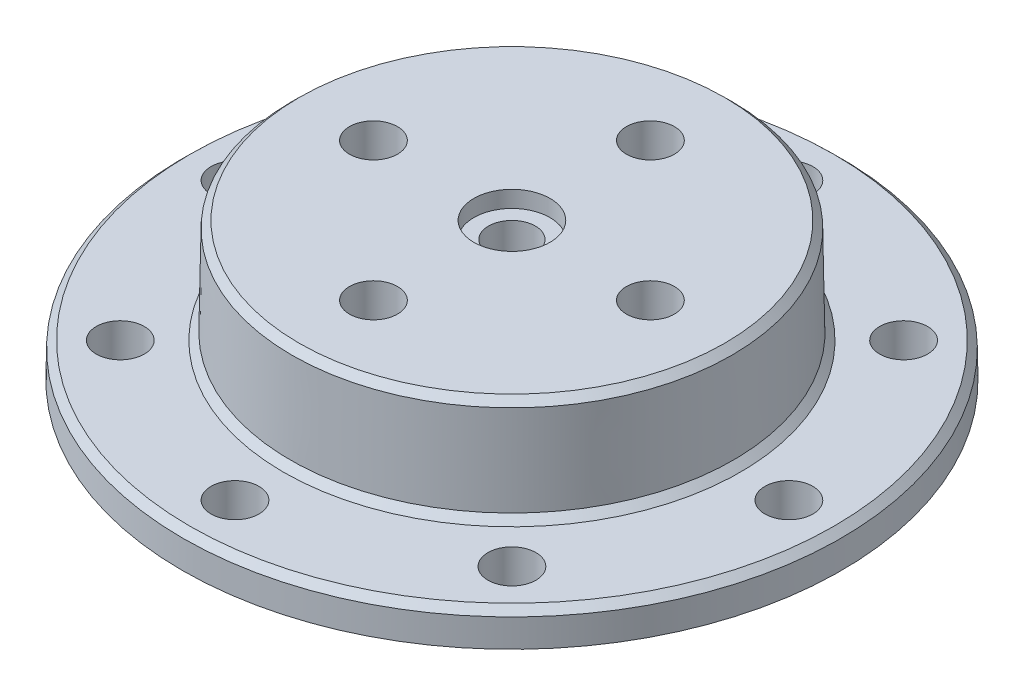
from build123d import *

# Parameters (mm, degrees)
SKETCH2_R                                        = 20.32
BOSS_EXTRUDE1_DEPTH                              = 9.525
BOSS_EXTRUDE1_TAPER                              = 1
CUT_EXTRUDE1_DEPTH                               = 1.675
CUT_EXTRUDE2_DEPTH                               = 1.675
CUT_EXTRUDE3_DEPTH                               = 1.675
CUT_EXTRUDE4_DEPTH                               = 1.675
CUT_EXTRUDE5_DEPTH                               = 1.675
CUT_EXTRUDE6_DEPTH                               = 1.675
CUT_EXTRUDE7_DEPTH                               = 1.675
CUT_EXTRUDE8_DEPTH                               = 1.675
SKETCH11_W                                       = 4
SKETCH11_H                                       = 6.374
F_4_4_4_4_DIAMETER_HOLE1_D                       = 4.4
F_4_4_4_4_DIAMETER_HOLE2_D                       = 4.4
CBORE_FOR_M4_HEX_HEAD_MACHINE_SCREW1_D           = 4.3
CBORE_FOR_M4_HEX_HEAD_MACHINE_SCREW1_CBORE_D     = 6.985
CBORE_FOR_M4_HEX_HEAD_MACHINE_SCREW1_CBORE_DEPTH = 1.524
CHAMFER1_SIZE                                    = 0.635014452
CHAMFER1_SIZE2                                   = 0.635014007
CHAMFER2_SIZE                                    = 0.634991023
CHAMFER2_SIZE_2                                  = 0.634990726
CHAMFER3_SIZE                                    = 0.635002922
CHAMFER3_SIZE2                                   = 0.635003014


with BuildPart() as part:
    # Sketch1 → Revolve1 (revolve)
    with BuildSketch(Plane(origin=(0, 0, 0), x_dir=(-1, 0, 0), z_dir=(0, 0, -1)), mode=Mode.PRIVATE) as revolve1_sk:
        Polygon((-30.226, -3.175), (-18.82, -3.175), (-18.764580169, 0), (-30.170580169, 0), align=None)
    revolve(revolve1_sk.sketch.rotate(Axis((0, -3.175, 0), (0, 1, 0)), 270), axis=Axis((0, -3.175, 0), (0, 1, 0)))

    # Sketch2 → Boss-Extrude1 (add)
    with BuildSketch(Plane(origin=(0, 0, 0), x_dir=(-1, 0, 0), z_dir=(0, 1, 0))):
        Circle(SKETCH2_R)
    extrude(amount=BOSS_EXTRUDE1_DEPTH, taper=BOSS_EXTRUDE1_TAPER)

    # Sketch3 → Cut-Extrude1 (cut)
    with BuildSketch(Plane.XZ.offset(3.175)):
        with BuildLine():
            Line((-0.75, 20.30615424), (-0.75, 21.725765386))
            ThreePointArc((-0.75, 21.725765386), (-3.704512163, 24.817685966), (-1.841086622, 28.666940472))
            ThreePointArc((-1.841086622, 28.666940472), (-10.992964278, 26.539363451), (-18.968743169, 21.572432839))
            ThreePointArc((-18.968743169, 21.572432839), (-14.929268369, 20.168239712), (-14.832105945, 15.892766117))
            Line((-14.832105945, 15.892766117), (-13.828289277, 14.888949448))
            ThreePointArc((-13.828289277, 14.888949448), (-7.776127346, 18.773232101), (-0.75, 20.30615424))
        make_face()
    extrude(amount=-CUT_EXTRUDE1_DEPTH, mode=Mode.SUBTRACT)

    # Sketch4 → Cut-Extrude2 (cut)
    with BuildSketch(Plane.XZ.offset(3.175)):
        with BuildLine():
            Line((0.75, 21.725765386), (0.75, 20.30615424))
            ThreePointArc((0.75, 20.30615424), (7.776127346, 18.773232101), (13.828289277, 14.888949448))
            Line((13.828289277, 14.888949448), (14.832105945, 15.892766117))
            ThreePointArc((14.832105945, 15.892766117), (14.929268369, 20.168239712), (18.968743169, 21.572432839))
            ThreePointArc((18.968743169, 21.572432839), (10.992964278, 26.539363451), (1.841086622, 28.666940472))
            ThreePointArc((1.841086622, 28.666940472), (3.704512163, 24.817685966), (0.75, 21.725765386))
        make_face()
    extrude(amount=-CUT_EXTRUDE2_DEPTH, mode=Mode.SUBTRACT)

    # Sketch5 → Cut-Extrude3 (cut)
    with BuildSketch(Plane.XZ.offset(3.175)):
        with BuildLine():
            Line((15.892766117, 14.832105945), (14.888949448, 13.828289277))
            ThreePointArc((14.888949448, 13.828289277), (18.773232101, 7.776127346), (20.30615424, 0.75))
            Line((20.30615424, 0.75), (21.725765386, 0.75))
            ThreePointArc((21.725765386, 0.75), (24.817685966, 3.704512163), (28.666940472, 1.841086622))
            ThreePointArc((28.666940472, 1.841086622), (26.539363451, 10.992964278), (21.572432839, 18.968743169))
            ThreePointArc((21.572432839, 18.968743169), (20.168239712, 14.929268369), (15.892766117, 14.832105945))
        make_face()
    extrude(amount=-CUT_EXTRUDE3_DEPTH, mode=Mode.SUBTRACT)

    # Sketch6 → Cut-Extrude4 (cut)
    with BuildSketch(Plane.XZ.offset(3.175)):
        with BuildLine():
            Line((21.725765386, -0.75), (20.30615424, -0.75))
            ThreePointArc((20.30615424, -0.75), (18.773232101, -7.776127346), (14.888949448, -13.828289277))
            Line((14.888949448, -13.828289277), (15.892766117, -14.832105945))
            ThreePointArc((15.892766117, -14.832105945), (20.168239712, -14.929268369), (21.572432839, -18.968743169))
            ThreePointArc((21.572432839, -18.968743169), (26.539363451, -10.992964278), (28.666940472, -1.841086622))
            ThreePointArc((28.666940472, -1.841086622), (24.817685966, -3.704512163), (21.725765386, -0.75))
        make_face()
    extrude(amount=-CUT_EXTRUDE4_DEPTH, mode=Mode.SUBTRACT)

    # Sketch7 → Cut-Extrude5 (cut)
    with BuildSketch(Plane.XZ.offset(3.175)):
        with BuildLine():
            Line((14.832105945, -15.892766117), (13.828289277, -14.888949448))
            ThreePointArc((13.828289277, -14.888949448), (7.776127346, -18.773232101), (0.75, -20.30615424))
            Line((0.75, -20.30615424), (0.75, -21.725765386))
            ThreePointArc((0.75, -21.725765386), (3.704512163, -24.817685966), (1.841086622, -28.666940472))
            ThreePointArc((1.841086622, -28.666940472), (10.992964278, -26.539363451), (18.968743169, -21.572432839))
            ThreePointArc((18.968743169, -21.572432839), (14.929268369, -20.168239712), (14.832105945, -15.892766117))
        make_face()
    extrude(amount=-CUT_EXTRUDE5_DEPTH, mode=Mode.SUBTRACT)

    # Sketch8 → Cut-Extrude6 (cut)
    with BuildSketch(Plane.XZ.offset(3.175)):
        with BuildLine():
            Line((-0.75, -21.725765386), (-0.75, -20.30615424))
            ThreePointArc((-0.75, -20.30615424), (-7.776127346, -18.773232101), (-13.828289277, -14.888949448))
            Line((-13.828289277, -14.888949448), (-14.832105945, -15.892766117))
            ThreePointArc((-14.832105945, -15.892766117), (-14.929268369, -20.168239712), (-18.968743169, -21.572432839))
            ThreePointArc((-18.968743169, -21.572432839), (-10.992964278, -26.539363451), (-1.841086622, -28.666940472))
            ThreePointArc((-1.841086622, -28.666940472), (-3.704512163, -24.817685966), (-0.75, -21.725765386))
        make_face()
    extrude(amount=-CUT_EXTRUDE6_DEPTH, mode=Mode.SUBTRACT)

    # Sketch9 → Cut-Extrude7 (cut)
    with BuildSketch(Plane.XZ.offset(3.175)):
        with BuildLine():
            Line((-15.892766117, -14.832105945), (-14.888949448, -13.828289277))
            ThreePointArc((-14.888949448, -13.828289277), (-18.773232101, -7.776127346), (-20.30615424, -0.75))
            Line((-20.30615424, -0.75), (-21.725765386, -0.75))
            ThreePointArc((-21.725765386, -0.75), (-24.817685966, -3.704512163), (-28.666940472, -1.841086622))
            ThreePointArc((-28.666940472, -1.841086622), (-26.539363451, -10.992964278), (-21.572432839, -18.968743169))
            ThreePointArc((-21.572432839, -18.968743169), (-20.168239712, -14.929268369), (-15.892766117, -14.832105945))
        make_face()
    extrude(amount=-CUT_EXTRUDE7_DEPTH, mode=Mode.SUBTRACT)

    # Sketch10 → Cut-Extrude8 (cut)
    with BuildSketch(Plane.XZ.offset(3.175)):
        with BuildLine():
            Line((-21.725765386, 0.75), (-20.30615424, 0.75))
            ThreePointArc((-20.30615424, 0.75), (-18.773232101, 7.776127346), (-14.888949448, 13.828289277))
            Line((-14.888949448, 13.828289277), (-15.892766117, 14.832105945))
            ThreePointArc((-15.892766117, 14.832105945), (-20.168239712, 14.929268369), (-21.572432839, 18.968743169))
            ThreePointArc((-21.572432839, 18.968743169), (-26.539363451, 10.992964278), (-28.666940472, 1.841086622))
            ThreePointArc((-28.666940472, 1.841086622), (-24.817685966, 3.704512163), (-21.725765386, 0.75))
        make_face()
    extrude(amount=-CUT_EXTRUDE8_DEPTH, mode=Mode.SUBTRACT)

    # Sketch11 → Revolve2 (revolve)
    with BuildSketch(Plane.XY, mode=Mode.PRIVATE) as revolve2_sk:
        with Locations((2, 4.838)):
            Rectangle(SKETCH11_W, SKETCH11_H)
    revolve(revolve2_sk.sketch.rotate(Axis((0, 8.025, 0), (0, -1, 0)), 90), axis=Axis((0, 8.025, 0), (0, -1, 0)))

    # Ø4.4 (4.4) Diameter Hole1 (through all)
    with Locations(Plane(origin=(0, 0, 0), x_dir=(1, 0, 0), z_dir=(0, 1, 0))):
        with Locations((25.4, 0), (17.960512242, 17.960512242), (0, 25.4), (-17.960512242, 17.960512242), (-25.4, 0), (-17.960512242, -17.960512242), (0, -25.4), (17.960512242, -17.960512242)):
            Hole(F_4_4_4_4_DIAMETER_HOLE1_D / 2)

    # Ø4.4 (4.4) Diameter Hole2 (through all)
    with Locations(Plane(origin=(0, 9.525, 0), x_dir=(1, 0, 0), z_dir=(0, 1, 0))):
        with Locations((12.7, 0), (0, 12.7), (-12.7, 0), (0, -12.7)):
            Hole(F_4_4_4_4_DIAMETER_HOLE2_D / 2)

    # CBORE for M4 Hex Head Machine Screw1 (through all)
    with Locations(Plane(origin=(0, 9.525, 0), x_dir=(1, 0, 0), z_dir=(0, 1, 0))):
        with Locations((0, 0)):
            CounterBoreHole(CBORE_FOR_M4_HEX_HEAD_MACHINE_SCREW1_D / 2, CBORE_FOR_M4_HEX_HEAD_MACHINE_SCREW1_CBORE_D / 2, CBORE_FOR_M4_HEX_HEAD_MACHINE_SCREW1_CBORE_DEPTH)

    # Chamfer1
    chamfer1_edges = [part.edges().sort_by_distance(p)[0] for p in [
        (20.32, 0, 0),
    ]]
    chamfer1_side = [part.faces().sort_by_distance(p)[0] for p in [
        (0, 0, -29.317227296),
    ]]
    chamfer(chamfer1_edges, length=CHAMFER1_SIZE, length2=CHAMFER1_SIZE2, reference=chamfer1_side[0])

    # Chamfer2
    # the kernel refuses this chamfer: 0.634991023, 0.634990726 mm, written as the material it takes off along each edge
    with BuildSketch(Plane(origin=(0, 9.525, 0), x_dir=(-1, 0, 0), z_dir=(0, 0, 1))) as chamfer2_piece_1:
        Polygon((20.153740507 + CHAMFER2_SIZE * 0.0174524064387, CHAMFER2_SIZE * 0.999847695238), (20.153740507 - CHAMFER2_SIZE_2, 0), (20.153740507, 0), align=None)
    revolve(axis=Axis((0, 9.525, 0), (0, -1, 0)), mode=Mode.SUBTRACT)

    # Chamfer3
    chamfer3_edges = [part.edges().sort_by_distance(p)[0] for p in [
        (0, 0, -30.170580169),
    ]]
    chamfer3_side = [part.faces().sort_by_distance(p)[0] for p in [
        (21.808367326, 0, 0),
    ]]
    chamfer(chamfer3_edges, length=CHAMFER3_SIZE, length2=CHAMFER3_SIZE2, reference=chamfer3_side[0])


solid = part.part
